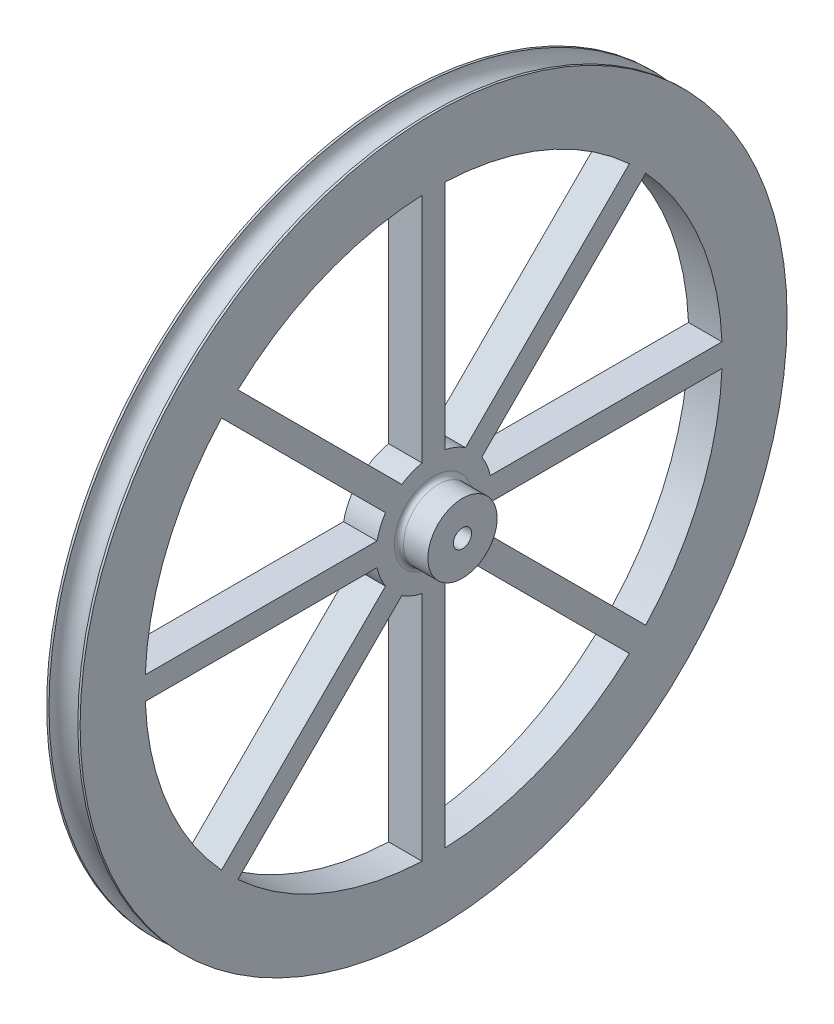
from build123d import *

# Parameters (mm, degrees)
SKETCH1_R           = 38.89375
BOSS_EXTRUDE1_DEPTH = 3.683
SKETCH10_R          = 1.5875
CUT_EXTRUDE3_DEPTH  = 56.127235257
SKETCH12_R          = 0.999998
CUT_EXTRUDE4_DEPTH  = 56.127235257
BOSS_EXTRUDE2_START = 3.175
SKETCH13_R          = 3.81
SKETCH13_R_2        = 0.999998
BOSS_EXTRUDE2_DEPTH = 3.175
FILLET1_R           = 0.508


with BuildPart() as part:
    # Sketch1 → Boss-Extrude1 (new body)
    with BuildSketch(Plane(origin=(0, 0, 0), x_dir=(0, 0, -1), z_dir=(1, 0, 0))):
        Circle(SKETCH1_R)
    extrude(amount=BOSS_EXTRUDE1_DEPTH)

    # Sketch10 → Cut-Revolve1 (revolve, cut)
    with BuildSketch(Plane.XY):
        with Locations((1.8415, 38.89375)):
            Circle(SKETCH10_R)
    revolve(axis=Axis((-1.01619145, 0, 0), (1, 0, 0)), mode=Mode.SUBTRACT)

    # Sketch11 → Cut-Extrude3 (cut, through all)
    with BuildSketch(Plane(origin=(3.683, 0, 0), x_dir=(0, 0, -1), z_dir=(1, 0, 0))):
        with BuildLine():
            Line((-1.27, 31.724589832), (-1.27, 6.221703947))
            ThreePointArc((-1.27, 6.221703947), (-2.430039796, 5.866635031), (-3.501383439, 5.297434663))
            Line((-3.501383439, 5.297434663), (-21.534646988, 23.330698213))
            ThreePointArc((-21.534646988, 23.330698213), (-12.150198978, 29.333175157), (-1.27, 31.724589832))
        make_face()
        with BuildLine():
            Line((1.27, 31.724589832), (1.27, 6.221703947))
            ThreePointArc((1.27, 6.221703947), (2.430039796, 5.866635031), (3.501383439, 5.297434663))
            Line((3.501383439, 5.297434663), (21.534646988, 23.330698213))
            ThreePointArc((21.534646988, 23.330698213), (12.150198978, 29.333175157), (1.27, 31.724589832))
        make_face()
        with BuildLine():
            Line((23.330698213, 21.534646988), (5.297434663, 3.501383439))
            ThreePointArc((5.297434663, 3.501383439), (5.866635031, 2.430039796), (6.221703947, 1.27))
            Line((6.221703947, 1.27), (31.724589832, 1.27))
            ThreePointArc((31.724589832, 1.27), (29.333175157, 12.150198978), (23.330698213, 21.534646988))
        make_face()
        with BuildLine():
            Line((31.724589832, -1.27), (6.221703947, -1.27))
            ThreePointArc((6.221703947, -1.27), (5.866635031, -2.430039796), (5.297434663, -3.501383439))
            Line((5.297434663, -3.501383439), (23.330698213, -21.534646988))
            ThreePointArc((23.330698213, -21.534646988), (29.333175157, -12.150198978), (31.724589832, -1.27))
        make_face()
        with BuildLine():
            Line((21.534646988, -23.330698213), (3.501383439, -5.297434663))
            ThreePointArc((3.501383439, -5.297434663), (2.430039796, -5.866635031), (1.27, -6.221703947))
            Line((1.27, -6.221703947), (1.27, -31.724589832))
            ThreePointArc((1.27, -31.724589832), (12.150198978, -29.333175157), (21.534646988, -23.330698213))
        make_face()
        with BuildLine():
            Line((-1.27, -31.724589832), (-1.27, -6.221703947))
            ThreePointArc((-1.27, -6.221703947), (-2.430039796, -5.866635031), (-3.501383439, -5.297434663))
            Line((-3.501383439, -5.297434663), (-21.534646988, -23.330698213))
            ThreePointArc((-21.534646988, -23.330698213), (-12.150198978, -29.333175157), (-1.27, -31.724589832))
        make_face()
        with BuildLine():
            Line((-23.330698213, -21.534646988), (-5.297434663, -3.501383439))
            ThreePointArc((-5.297434663, -3.501383439), (-5.866635031, -2.430039796), (-6.221703947, -1.27))
            Line((-6.221703947, -1.27), (-31.724589832, -1.27))
            ThreePointArc((-31.724589832, -1.27), (-29.333175157, -12.150198978), (-23.330698213, -21.534646988))
        make_face()
        with BuildLine():
            Line((-31.724589832, 1.27), (-6.221703947, 1.27))
            ThreePointArc((-6.221703947, 1.27), (-5.866635031, 2.430039796), (-5.297434663, 3.501383439))
            Line((-5.297434663, 3.501383439), (-23.330698213, 21.534646988))
            ThreePointArc((-23.330698213, 21.534646988), (-29.333175157, 12.150198978), (-31.724589832, 1.27))
        make_face()
    extrude(amount=-CUT_EXTRUDE3_DEPTH, mode=Mode.SUBTRACT)

    # Sketch12 → Cut-Extrude4 (cut, through all)
    with BuildSketch(Plane(origin=(3.683, 0, 0), x_dir=(0, 0, -1), z_dir=(1, 0, 0))):
        Circle(SKETCH12_R)
    extrude(amount=-CUT_EXTRUDE4_DEPTH, mode=Mode.SUBTRACT)

    # Sketch13 → Boss-Extrude2 (add)
    with BuildSketch(Plane(origin=(3.683, 0, 0), x_dir=(0, 0, -1), z_dir=(1, 0, 0)).offset(BOSS_EXTRUDE2_START)):
        Circle(SKETCH13_R)
        Circle(SKETCH13_R_2, mode=Mode.SUBTRACT)
    extrude(amount=-BOSS_EXTRUDE2_DEPTH)

    # Fillet1
    fillet1_edges = [part.edges().sort_by_distance(p)[0] for p in [
        (3.683, 0, 3.81),
    ]]
    fillet(fillet1_edges, radius=FILLET1_R)


solid = part.part
